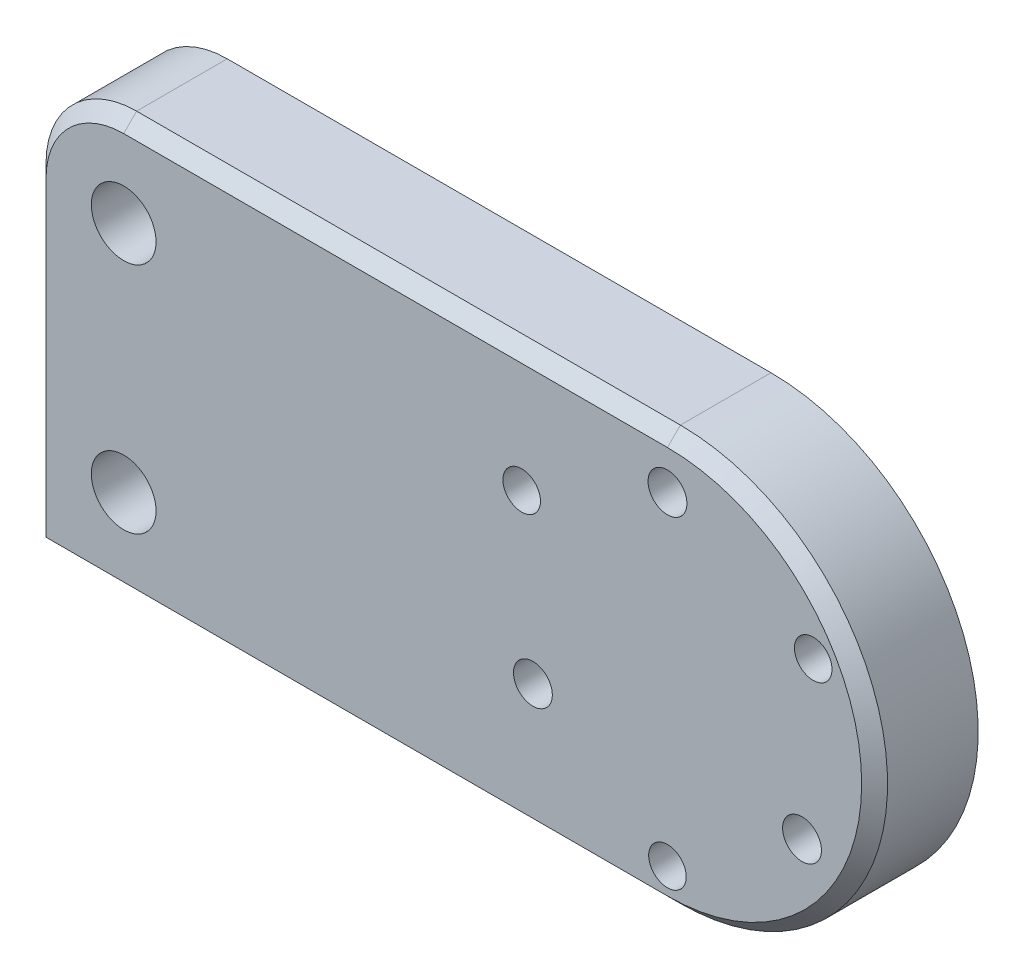
from build123d import *

# Parameters (mm, degrees)
SKETCH_1_R      = 1.45
SKETCH_1_R_2    = 1.5
SKETCH_1_R_3    = 2.5
EXTRUDE_1_DEPTH = 8
CHAMFER_1_SIZE  = 1
CHAMFER_2_SIZE  = 1


with BuildPart() as part:
    # 草图1 → 凸台-拉伸1 (new body)
    with BuildSketch(Plane.XY):
        with BuildLine():
            Line((0, 16), (-42, 16))
            ThreePointArc((-42, 16), (-46.949747468, 13.949747468), (-49, 9))
            Line((-49, 9), (-49, -16))
            Line((-49, -16), (0, -16))
            ThreePointArc((0, -16), (16, 0), (0, 16))
        make_face()
        with Locations((0, -13)):
            Circle(SKETCH_1_R, mode=Mode.SUBTRACT)
        with Locations((10.392304845, -6)):
            Circle(SKETCH_1_R_2, mode=Mode.SUBTRACT)
        with Locations((11.258330249, 6.5)):
            Circle(SKETCH_1_R, mode=Mode.SUBTRACT)
        with Locations((-10.392304845, -6)):
            Circle(SKETCH_1_R_2, mode=Mode.SUBTRACT)
        with Locations((-11.258330249, 6.5)):
            Circle(SKETCH_1_R, mode=Mode.SUBTRACT)
        with Locations((0, 12)):
            Circle(SKETCH_1_R_2, mode=Mode.SUBTRACT)
        with Locations((-42, 9)):
            Circle(SKETCH_1_R_3, mode=Mode.SUBTRACT)
        with Locations((-42, -9)):
            Circle(SKETCH_1_R_3, mode=Mode.SUBTRACT)
    extrude(amount=EXTRUDE_1_DEPTH)

    # 倒角1
    chamfer_1_edges = [part.edges().sort_by_distance(p)[0] for p in [
        (-49, -16, 4),
    ]]
    chamfer(chamfer_1_edges, length=CHAMFER_1_SIZE)

    # 倒角2
    # the kernel refuses this chamfer: 1 mm, written as the material it takes off along each edge
    with BuildSketch(Plane(origin=(-50.571682988, -16, 8), x_dir=(0, 0.9996219169112968, 0.027495876610585647), z_dir=(1, 0, 0))) as chamfer_2_piece_1:
        Polygon((CHAMFER_2_SIZE * 0.999621916911, -CHAMFER_2_SIZE * 0.0274958766106), (-CHAMFER_2_SIZE * 0.0274958766106, -CHAMFER_2_SIZE * 0.999621916911), (0, 0), align=None)
    extrude(amount=50.571682988, mode=Mode.SUBTRACT)
    with BuildSketch(Plane(origin=(-49, 9, 8), x_dir=(-0.02749587661058907, 0, -0.9996219169112965), z_dir=(0, -1, 0))) as chamfer_2_piece_2:
        Polygon((CHAMFER_2_SIZE * 0.999621916911, CHAMFER_2_SIZE * 0.0274958766106), (-CHAMFER_2_SIZE * 0.0274958766106, CHAMFER_2_SIZE * 0.999621916911), (0, 0), align=None)
    extrude(amount=26.571682988, mode=Mode.SUBTRACT)
    with BuildSketch(Plane(origin=(0, 0, 8), x_dir=(0, -1, 0), z_dir=(-1, 0, 0))) as chamfer_2_piece_3:
        Polygon((16 - CHAMFER_2_SIZE, 0), (16, -CHAMFER_2_SIZE), (16, 0), align=None)
    revolve(axis=Axis((0, 0, 8), (0, 0, 1)), revolution_arc=180, mode=Mode.SUBTRACT)
    with BuildSketch(Plane(origin=(-42, 9, 8), x_dir=(0, 1, 0), z_dir=(1, 0, 0))) as chamfer_2_piece_4:
        Polygon((7, -CHAMFER_2_SIZE), (7 - CHAMFER_2_SIZE, 0), (7, 0), align=None)
    revolve(axis=Axis((-42, 9, 8), (0, 0, 1)), revolution_arc=90, mode=Mode.SUBTRACT)
    with BuildSketch(Plane(origin=(0, 16, 8), x_dir=(0, -0.9996219169112968, 0.027495876610585647), z_dir=(-1, 0, 0))) as chamfer_2_piece_5:
        Polygon((CHAMFER_2_SIZE * 0.999621916911, -CHAMFER_2_SIZE * 0.0274958766106), (-CHAMFER_2_SIZE * 0.0274958766106, -CHAMFER_2_SIZE * 0.999621916911), (0, 0), align=None)
    extrude(amount=42, mode=Mode.SUBTRACT)


solid = part.part
